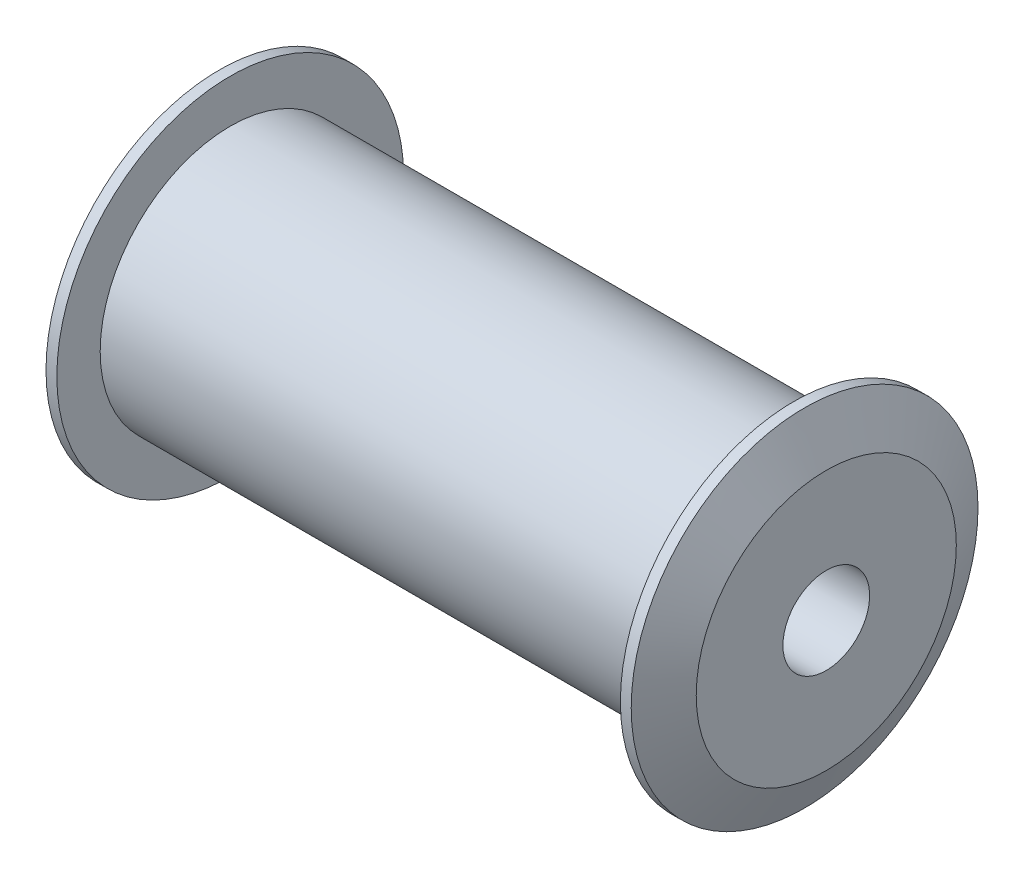
from build123d import *

# Parameters (mm, degrees)
CHAMFER_1_SIZE  = 1
CHAMFER_1_SIZE2 = 2
CHAMFER_2_SIZE  = 2
CHAMFER_2_SIZE2 = 1


with BuildPart() as part:
    # 草图2 → 旋转1 (revolve)
    with BuildSketch(Plane.XY):
        Polygon((-13, 53), (13, 53), (13, 55), (14.5, 55), (14.5, 49), (-14.5, 49), (-14.5, 55), (-13, 55), align=None)
    revolve(axis=Axis((-54.733238043, 47, 0), (1, 0, 0)))

    # 倒角1
    chamfer_1_edges = [part.edges().sort_by_distance(p)[0] for p in [
        (-14.5, 39, 0),
    ]]
    chamfer_1_side = [part.faces().sort_by_distance(p)[0] for p in [
        (-13.75, 39, 0),
    ]]
    chamfer(chamfer_1_edges, length=CHAMFER_1_SIZE, length2=CHAMFER_1_SIZE2, reference=chamfer_1_side[0])

    # 倒角2
    chamfer_2_edges = [part.edges().sort_by_distance(p)[0] for p in [
        (14.5, 39, 0),
    ]]
    chamfer_2_side = [part.faces().sort_by_distance(p)[0] for p in [
        (14.5, 39.22627417, 0),
    ]]
    chamfer(chamfer_2_edges, length=CHAMFER_2_SIZE, length2=CHAMFER_2_SIZE2, reference=chamfer_2_side[0])


solid = part.part
